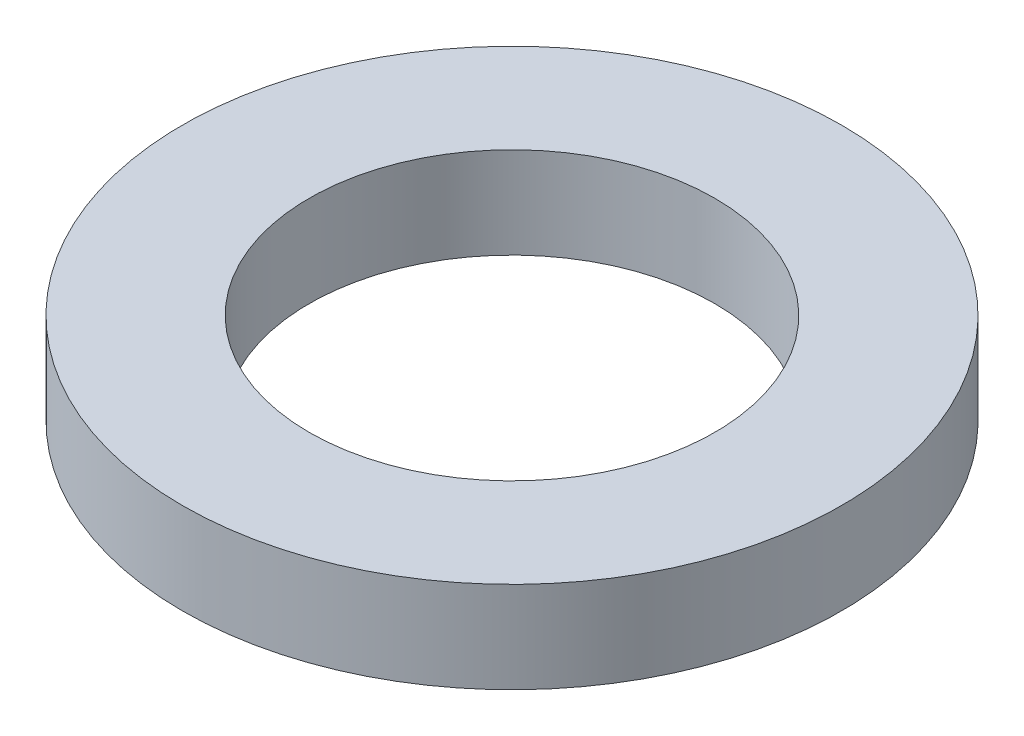
from build123d import *

# Parameters (mm, degrees)
SKETCH1_R           = 65
BOSS_EXTRUDE1_DEPTH = 18
SKETCH2_R           = 40
CUT_EXTRUDE1_DEPTH  = 94.669632219


with BuildPart() as part:
    # Sketch1 → Boss-Extrude1 (new body)
    with BuildSketch(Plane(origin=(0, 0, 0), x_dir=(1, 0, 0), z_dir=(0, 1, 0))):
        Circle(SKETCH1_R)
    extrude(amount=BOSS_EXTRUDE1_DEPTH)

    # Sketch2 → Cut-Extrude1 (cut, through all)
    with BuildSketch(Plane(origin=(0, 0, 0), x_dir=(1, 0, 0), z_dir=(0, 1, 0))):
        Circle(SKETCH2_R)
    extrude(amount=CUT_EXTRUDE1_DEPTH, mode=Mode.SUBTRACT)


solid = part.part
